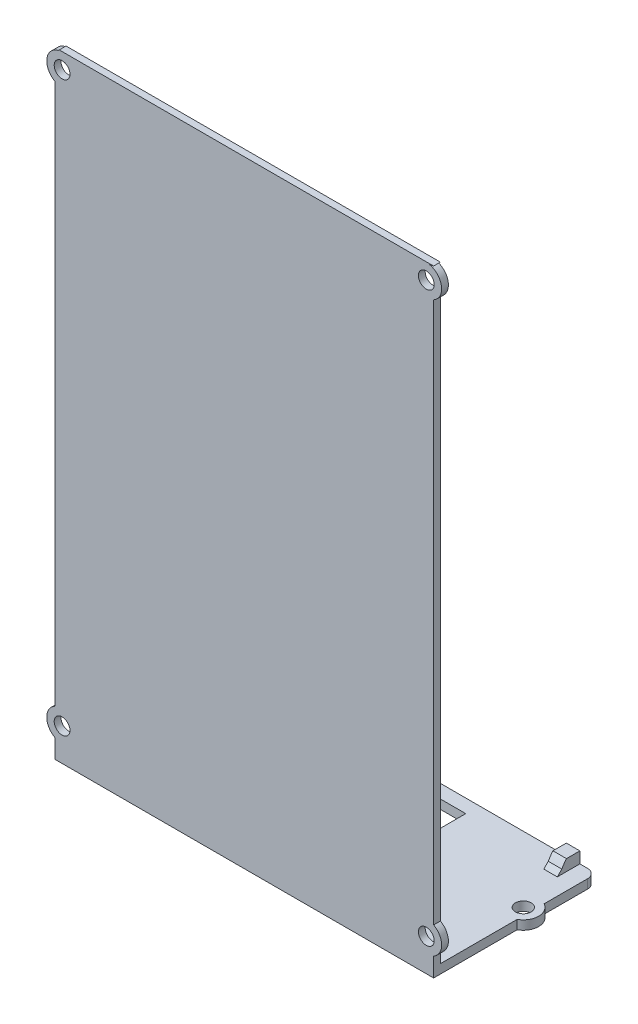
from build123d import *

# Parameters (mm, degrees)
SKETCH1_R                = 1.75
BOSS_EXTRUDE1_DEPTH      = 1.5
BOSS_EXTRUDE2_START      = -84
BOSS_EXTRUDE2_DEPTH      = 84
BOSS_EXTRUDE3_DEPTH      = 1.5
BOSS_EXTRUDE3_DEPTH_BACK = 1.5
BOSS_EXTRUDE4_DEPTH      = 2
SKETCH5_R                = 1.75
CUT_EXTRUDE1_DEPTH       = 2
CUT_EXTRUDE2_DEPTH       = 150.007183132
CUT_EXTRUDE2_DEPTH_BACK  = 150.007183132
SKETCH6_W                = 84
SKETCH6_H                = 5.379304891
BOSS_EXTRUDE6_START      = -2
SKETCH7_W                = 3
SKETCH7_H                = 4
BOSS_EXTRUDE6_DEPTH      = 2.5
FILLET1_R                = 2
CHAMFER1_SIZE            = 1
FILLET2_R                = 8
SKETCH8_W                = 26
SKETCH8_H                = 29.120695109
CUT_EXTRUDE3_DEPTH       = 22.4262221


with BuildPart() as part:
    # Sketch1 → Boss-Extrude1 (new body)
    with BuildSketch(Plane.XY):
        with BuildLine():
            Line((-38.75, -134.5), (38.75, -134.5))
            Line((38.75, -134.5), (42, -134.5))
            Line((42, -134.5), (42, -132.48653227))
            ThreePointArc((42, -132.48653227), (43.775, -129.5), (42, -126.51346773))
            Line((42, -126.51346773), (42, -6.48653227))
            ThreePointArc((42, -6.48653227), (43.741212037, -3.021861398), (41.104087703, -0.179091823))
            Line((41.104087703, -0.179091823), (42, 0))
            Line((42, 0), (-41, 0))
            Line((-41, 0), (-41.193033114, -0.199875483))
            ThreePointArc((-41.193033114, -0.199875483), (-43.747330957, -3.067121364), (-42, -6.48653227))
            Line((-42, -6.48653227), (-42, -126.51346773))
            ThreePointArc((-42, -126.51346773), (-43.775, -129.5), (-42, -132.48653227))
            Line((-42, -132.48653227), (-42, -134.5))
            Line((-42, -134.5), (-38.75, -134.5))
        make_face()
        with Locations((-40.375, -129.5)):
            Circle(SKETCH1_R, mode=Mode.SUBTRACT)
        with Locations((40.375, -129.5)):
            Circle(SKETCH1_R, mode=Mode.SUBTRACT)
        with Locations((40.375, -3.5)):
            Circle(SKETCH1_R, mode=Mode.SUBTRACT)
        with Locations((-40.375, -3.5)):
            Circle(SKETCH1_R, mode=Mode.SUBTRACT)
    extrude(amount=BOSS_EXTRUDE1_DEPTH)

    # Sketch2 → Boss-Extrude2 (add)
    with BuildSketch(Plane.ZY.offset(42).offset(BOSS_EXTRUDE2_START)):
        Polygon((1.5, -136.7), (1.5, -134.5), (0, -134.5), (0, -134.7), (-40, -134.7), (-40, -136.7), align=None)
    extrude(amount=BOSS_EXTRUDE2_DEPTH)

    # Sketch3 → Boss-Extrude3 (add, two sides: drawn at the far end of the back side and taken through both)
    with BuildSketch(Plane(origin=(-15, 0, 0), x_dir=(0, 0, -1), z_dir=(1, 0, 0)).offset(-BOSS_EXTRUDE3_DEPTH_BACK)):
        Polygon((0, -119.7), (15, -134.7), (0, -134.7), align=None)
    extrude(amount=BOSS_EXTRUDE3_DEPTH + BOSS_EXTRUDE3_DEPTH_BACK)

    # Sketch4 → Boss-Extrude4 (add)
    with BuildSketch(Plane.XZ.offset(136.7)):
        with BuildLine():
            Line((-42, -17.01346773), (-42, -22.98653227))
            ThreePointArc((-42, -22.98653227), (-43.775, -20), (-42, -17.01346773))
        make_face()
        with BuildLine():
            Line((42, -17.01346773), (42, -22.98653227))
            ThreePointArc((42, -22.98653227), (43.775, -20), (42, -17.01346773))
        make_face()
    extrude(amount=-BOSS_EXTRUDE4_DEPTH)

    # Sketch5 → Cut-Extrude1 (cut)
    with BuildSketch(Plane.XZ.offset(136.7)):
        with Locations(Location((40.375, -20, 0), (0, 0, 270))):
            Circle(SKETCH5_R)
        with Locations(Location((-40.375, -20, 0), (0, 0, 270))):
            Circle(SKETCH5_R)
    extrude(amount=-CUT_EXTRUDE1_DEPTH, mode=Mode.SUBTRACT)

    # Sketch6 → Cut-Extrude2 (cut, two sides: drawn at the far end of the back side and taken through both)
    with BuildSketch(Plane.XZ.offset(136.7).offset(-CUT_EXTRUDE2_DEPTH_BACK)):
        with Locations((0, -37.310347554)):
            Rectangle(SKETCH6_W, SKETCH6_H)
    extrude(amount=CUT_EXTRUDE2_DEPTH + CUT_EXTRUDE2_DEPTH_BACK, mode=Mode.SUBTRACT)

    # Sketch7 → Boss-Extrude6 (add)
    with BuildSketch(Plane.XZ.offset(136.7).offset(BOSS_EXTRUDE6_START)):
        with Locations((-36.8, -32.620695109)):
            Rectangle(SKETCH7_W, SKETCH7_H)
        with Locations((36.8, -32.620695109)):
            Rectangle(SKETCH7_W, SKETCH7_H)
    extrude(amount=-BOSS_EXTRUDE6_DEPTH)

    # Fillet1
    fillet1_edges = [part.edges().sort_by_distance(p)[0] for p in [
        (42, -135.7, -34.620695109),
        (-42, -135.7, -34.620695109),
    ]]
    fillet(fillet1_edges, radius=FILLET1_R)

    # Chamfer1
    chamfer1_edges = [part.edges().sort_by_distance(p)[0] for p in [
        (-36.8, -134.7, -30.620695109),
        (-36.8, -132.2, -30.620695109),
        (36.8, -134.7, -30.620695109),
        (36.8, -132.2, -30.620695109),
    ]]
    chamfer(chamfer1_edges, length=CHAMFER1_SIZE)

    # Fillet2
    # the kernel refuses this fillet: 8 mm, written as the material it takes off along each edge
    with BuildSketch(Plane(origin=(-30.303909917, -133.2, -30.620695109), x_dir=(0, -1.0, -1.111999381457983e-11), z_dir=(-1, 0, 0))) as fillet2_piece_1:
        with BuildLine():
            CenterArc((4.243746579, -7.06996192), FILLET2_R, 117.902496562, 17.097503438)
            Line((-1.413107671, -1.413107671), (0, 0))
            Line((0, 0), (0.5, 0))
        make_face()
    extrude(amount=12.992180166, mode=Mode.SUBTRACT)
    with BuildSketch(Plane(origin=(30.303909917, -133.2, -30.620695109), x_dir=(0, 0.7071067811865485, -0.7071067811865467), z_dir=(1, 0, 0))) as fillet2_piece_2:
        with BuildLine():
            CenterArc((1.998436033, -8), FILLET2_R, 90, 17.097503438)
            Line((-0.353553391, -0.353553391), (0, 0))
            Line((0, 0), (1.998436033, 0))
        make_face()
    extrude(amount=12.992180166, mode=Mode.SUBTRACT)

    # Sketch8 → Cut-Extrude3 (cut)
    with BuildSketch(Plane.XZ.offset(136.7)):
        with Locations((3, -17.060347555)):
            Rectangle(SKETCH8_W, SKETCH8_H)
    extrude(amount=-CUT_EXTRUDE3_DEPTH, mode=Mode.SUBTRACT)


solid = part.part
